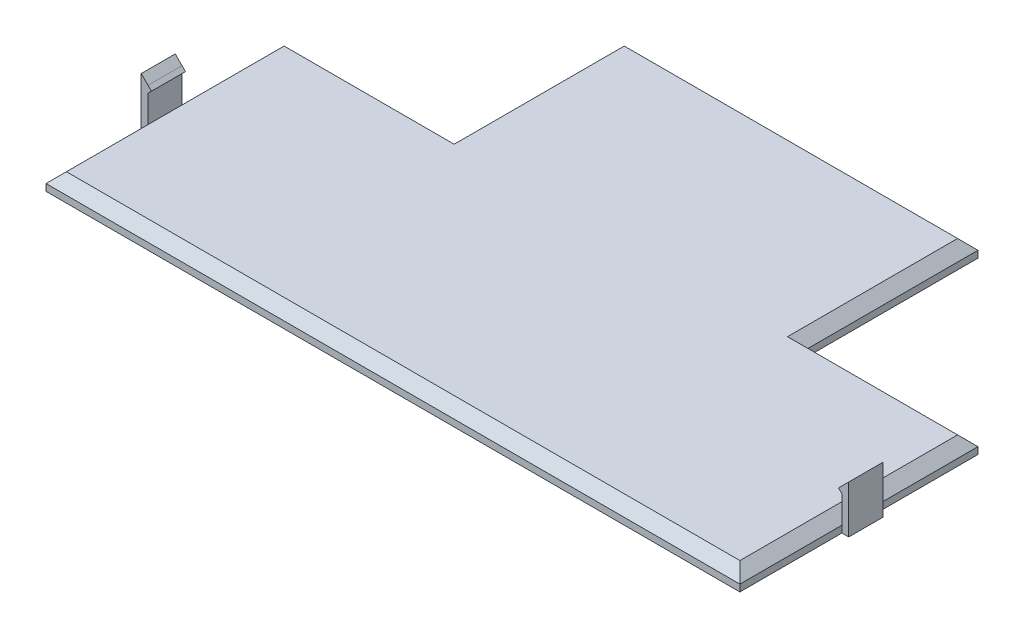
from build123d import *

# Parameters (mm, degrees)
BOSS_EXTRUDE1_DEPTH = 5
CHAMFER1_SIZE       = 3
SKETCH4_W           = 10
SKETCH4_H           = 2
BOSS_EXTRUDE3_DEPTH = 2
SKETCH5_W           = 2
SKETCH5_H           = 10
BOSS_EXTRUDE4_DEPTH = 12
CHAMFER2_SIZE       = 2
SKETCH6_W           = 10
SKETCH6_H           = 2
BOSS_EXTRUDE5_DEPTH = 1
CHAMFER3_SIZE       = 1
SKETCH7_W           = 10
SKETCH7_H           = 2
BOSS_EXTRUDE6_DEPTH = 2
SKETCH8_W           = 2
SKETCH8_H           = 10
BOSS_EXTRUDE7_DEPTH = 12
CHAMFER4_SIZE       = 2
SKETCH9_W           = 10
SKETCH9_H           = 2
BOSS_EXTRUDE8_DEPTH = 1
CHAMFER5_SIZE       = 1


with BuildPart() as part:
    # Sketch1 → Boss-Extrude1 (new body)
    with BuildSketch(Plane(origin=(0, 0, 0), x_dir=(1, 0, 0), z_dir=(0, 1, 0))):
        Polygon((-96.805555556, 26.527777778), (-46.805555556, 26.527777778), (-46.805555556, 76.527777778), (57.194444444, 76.527777778), (57.194444444, 26.527777778), (107.194444444, 26.527777778), (107.194444444, -43.472222222), (-96.805555556, -43.472222222), align=None)
    extrude(amount=BOSS_EXTRUDE1_DEPTH)

    # Chamfer1
    chamfer1_edges = [part.edges().sort_by_distance(p)[0] for p in [
        (107.194444444, 5, 8.472222222),
        (82.194444444, 5, -26.527777778),
        (57.194444444, 5, -51.527777778),
        (5.194444444, 5, -76.527777778),
        (-46.805555556, 5, -51.527777778),
        (-71.805555556, 5, -26.527777778),
        (-96.805555556, 5, 8.472222222),
        (5.194444444, 5, 43.472222222),
    ]]
    chamfer(chamfer1_edges, length=CHAMFER1_SIZE)

    # Sketch4 → Boss-Extrude3 (add)
    with BuildSketch(Plane(origin=(107.194444444, 0, 0), x_dir=(0, 0, -1), z_dir=(1, 0, 0))):
        with Locations((-8.472222222, 1)):
            Rectangle(SKETCH4_W, SKETCH4_H)
    extrude(amount=BOSS_EXTRUDE3_DEPTH)

    # Sketch5 → Boss-Extrude4 (add)
    with BuildSketch(Plane(origin=(0, 2, 0), x_dir=(1, 0, 0), z_dir=(0, 1, 0))):
        with Locations((108.194444444, -8.472222222)):
            Rectangle(SKETCH5_W, SKETCH5_H)
    extrude(amount=BOSS_EXTRUDE4_DEPTH)

    # Chamfer2
    chamfer2_edges = [part.edges().sort_by_distance(p)[0] for p in [
        (107.194444444, 14, 8.472222222),
    ]]
    chamfer(chamfer2_edges, length=CHAMFER2_SIZE - 0.0001)  # a hair under: the kernel refuses the full size

    # Sketch6 → Boss-Extrude5 (add)
    with BuildSketch(Plane.ZY.offset(-107.194444444)):
        with Locations((8.472222222, 11)):
            Rectangle(SKETCH6_W, SKETCH6_H)
    extrude(amount=BOSS_EXTRUDE5_DEPTH)

    # Chamfer3
    chamfer3_edges = [part.edges().sort_by_distance(p)[0] for p in [
        (106.194444444, 10, 8.472222222),
        (106.194444444, 12, 8.472222222),
    ]]
    chamfer(chamfer3_edges, length=CHAMFER3_SIZE - 0.0001)  # a hair under: the kernel refuses the full size

    # Sketch7 → Boss-Extrude6 (add)
    with BuildSketch(Plane.ZY.offset(96.805555556)):
        with Locations((8.472222222, 1)):
            Rectangle(SKETCH7_W, SKETCH7_H)
    extrude(amount=BOSS_EXTRUDE6_DEPTH)

    # Sketch8 → Boss-Extrude7 (add)
    with BuildSketch(Plane(origin=(0, 2, 0), x_dir=(1, 0, 0), z_dir=(0, 1, 0))):
        with Locations((-97.805555556, -8.472222222)):
            Rectangle(SKETCH8_W, SKETCH8_H)
    extrude(amount=BOSS_EXTRUDE7_DEPTH)

    # Chamfer4
    chamfer4_edges = [part.edges().sort_by_distance(p)[0] for p in [
        (-96.805555556, 14, 8.472222222),
    ]]
    chamfer(chamfer4_edges, length=CHAMFER4_SIZE - 0.0001)  # a hair under: the kernel refuses the full size

    # Sketch9 → Boss-Extrude8 (add)
    with BuildSketch(Plane(origin=(-96.805555556, 0, 0), x_dir=(0, 0, -1), z_dir=(1, 0, 0))):
        with Locations((-8.472222222, 11)):
            Rectangle(SKETCH9_W, SKETCH9_H)
    extrude(amount=BOSS_EXTRUDE8_DEPTH)

    # Chamfer5
    chamfer5_edges = [part.edges().sort_by_distance(p)[0] for p in [
        (-95.805555556, 10, 8.472222222),
        (-95.805555556, 12, 8.472222222),
    ]]
    chamfer(chamfer5_edges, length=CHAMFER5_SIZE - 0.0001)  # a hair under: the kernel refuses the full size


solid = part.part
